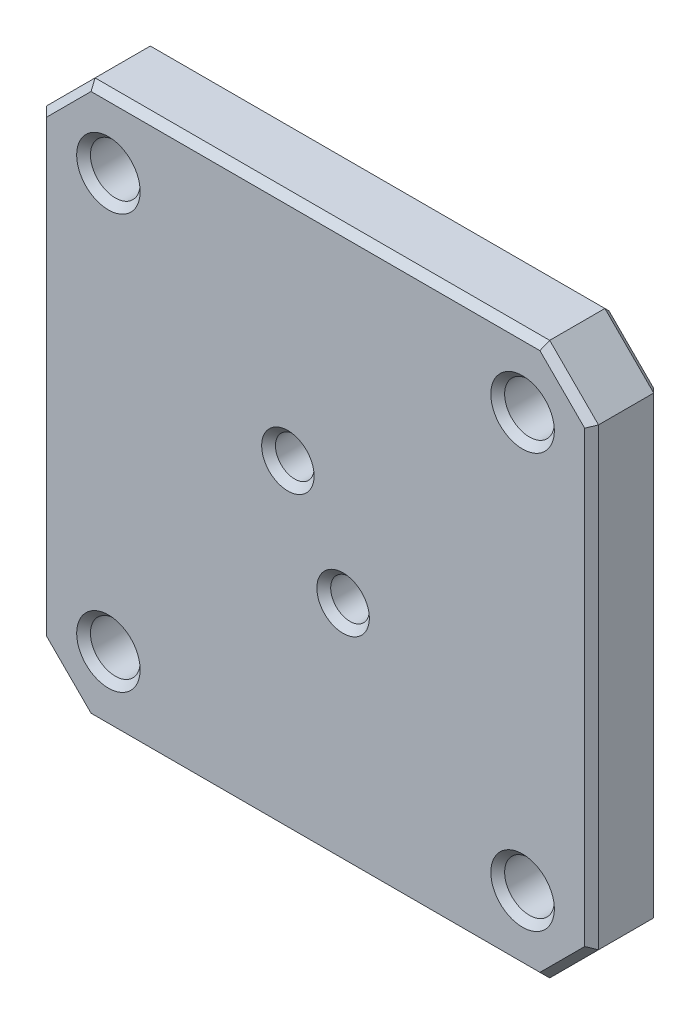
from build123d import *

# Parameters (mm, degrees)
SKETCH1_W           = 40
SKETCH1_H           = 40
BOSS_EXTRUDE1_DEPTH = 5
SKETCH2_R           = 1.8
CUT_EXTRUDE1_DEPTH  = 5
SKETCH3_R           = 1.4
CUT_EXTRUDE2_DEPTH  = 5
CHAMFER1_SIZE       = 3.536
CHAMFER2_SIZE       = 0.5


with BuildPart() as part:
    # Sketch1 → Boss-Extrude1 (new body)
    with BuildSketch(Plane.XY):
        with Locations((20, 20)):
            Rectangle(SKETCH1_W, SKETCH1_H)
    extrude(amount=BOSS_EXTRUDE1_DEPTH)

    # Sketch2 → Cut-Extrude1 (cut)
    with BuildSketch(Plane.XY.offset(5)):
        with Locations((5, 35)):
            Circle(SKETCH2_R)
        with Locations((35, 35)):
            Circle(SKETCH2_R)
        with Locations((5, 5)):
            Circle(SKETCH2_R)
        with Locations((35, 5)):
            Circle(SKETCH2_R)
    extrude(amount=-CUT_EXTRUDE1_DEPTH, mode=Mode.SUBTRACT)

    # Sketch3 → Cut-Extrude2 (cut)
    with BuildSketch(Plane.XY.offset(5)):
        with Locations((18, 23.464101615)):
            Circle(SKETCH3_R)
        with Locations((22, 16.535898385)):
            Circle(SKETCH3_R)
    extrude(amount=-CUT_EXTRUDE2_DEPTH, mode=Mode.SUBTRACT)

    # Chamfer1
    chamfer1_edges = [part.edges().sort_by_distance(p)[0] for p in [
        (0, 40, 2.5),
        (40, 40, 2.5),
        (40, 0, 2.5),
        (0, 0, 2.5),
    ]]
    chamfer(chamfer1_edges, length=CHAMFER1_SIZE)

    # Chamfer2
    chamfer2_edges = [part.edges().sort_by_distance(p)[0] for p in [
        (1.768, 1.768, 0),
        (20, 0, 0),
        (38.232, 1.768, 0),
        (40, 20, 0),
        (38.232, 38.232, 0),
        (20, 40, 0),
        (1.768, 38.232, 0),
        (0, 20, 0),
        (3.2, 35, 0),
        (33.2, 5, 0),
        (3.2, 5, 0),
        (33.2, 35, 0),
        (20.6, 16.535898385, 0),
        (16.6, 23.464101615, 0),
        (38.232, 38.232, 5),
        (40, 20, 5),
        (38.232, 1.768, 5),
        (20, 0, 5),
        (1.768, 1.768, 5),
        (0, 20, 5),
        (1.768, 38.232, 5),
        (20, 40, 5),
        (3.2, 35, 5),
        (33.2, 5, 5),
        (3.2, 5, 5),
        (33.2, 35, 5),
        (20.6, 16.535898385, 5),
        (16.6, 23.464101615, 5),
    ]]
    chamfer(chamfer2_edges, length=CHAMFER2_SIZE)


solid = part.part
